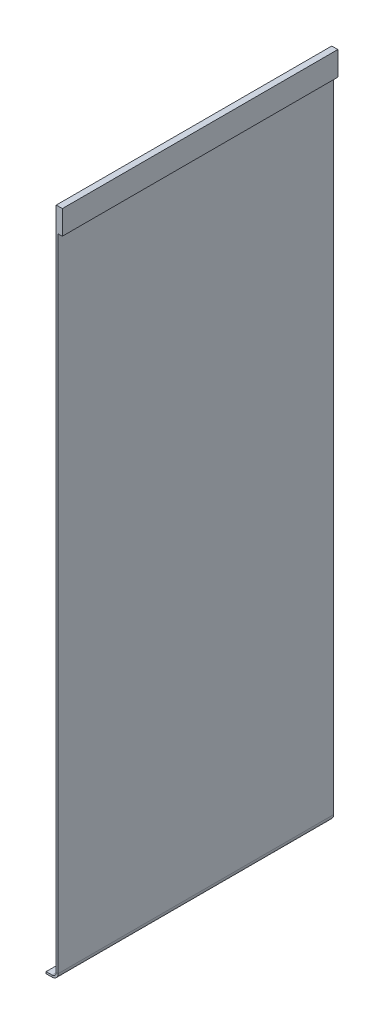
from build123d import *

# Parameters (mm, degrees)
SKETCH1_W                    = 73.025
SKETCH1_H                    = 177.8
BASE_FLANGE1_DEPTH           = 0.508
SKETCH2_W                    = 73.025
SKETCH2_H                    = 6.35
BOSS_EXTRUDE1_DEPTH          = 1.11125
EDGE_FLANGE1_STRIP_W         = 4.2545
EDGE_FLANGE1_STRIP_H         = 0.508
EDGE_FLANGE1_STRIP_CUT_DEPTH = 73.025
EDGE_FLANGE1_DEPTH           = 73.025


# Sheet-metal steps are written as plain solids
with BuildPart() as part:
    # Sketch1 → Base-Flange1 (new body)
    with BuildSketch(Plane(origin=(0, 0, 0), x_dir=(0, 0, -1), z_dir=(1, 0, 0))):
        with Locations((36.5125, 88.9)):
            Rectangle(SKETCH1_W, SKETCH1_H)
    extrude(amount=-BASE_FLANGE1_DEPTH)

    # Sketch2 → Boss-Extrude1 (add)
    with BuildSketch(Plane(origin=(0, 0, 0), x_dir=(0, 0, -1), z_dir=(1, 0, 0))):
        with Locations((36.5125, 174.625)):
            Rectangle(SKETCH2_W, SKETCH2_H)
    extrude(amount=BOSS_EXTRUDE1_DEPTH)

    # Edge-Flange1 strip (across the edge) → Edge-Flange1 strip cut (cut)
    with BuildSketch(Plane(origin=(-0.508, 0, -73.025), x_dir=(0, 1, 0), z_dir=(0, 0, 1))):
        with Locations((-0.508, -0.254)):
            Rectangle(EDGE_FLANGE1_STRIP_W, EDGE_FLANGE1_STRIP_H)
    extrude(amount=EDGE_FLANGE1_STRIP_CUT_DEPTH, mode=Mode.SUBTRACT)

    # Edge-Flange1 section (across the edge) → Edge-Flange1 (add)
    with BuildSketch(Plane(origin=(-0.508, 0, -73.025), x_dir=(0, 1, 0), z_dir=(0, 0, 1))):
        with BuildLine():
            Line((0, 1.11125), (0, 2.667))
            Line((0, 2.667), (0.508, 2.667))
            Line((0.508, 2.667), (0.508, 1.11125))
            ThreePointArc((0.508, 1.11125), (0.833477589, 0.325477589), (1.61925, 0))
            Line((1.61925, 0), (1.61925, -0.508))
            ThreePointArc((1.61925, -0.508), (0.474267345, -0.033732655), (0, 1.11125))
        make_face()
    extrude(amount=EDGE_FLANGE1_DEPTH)


solid = part.part
